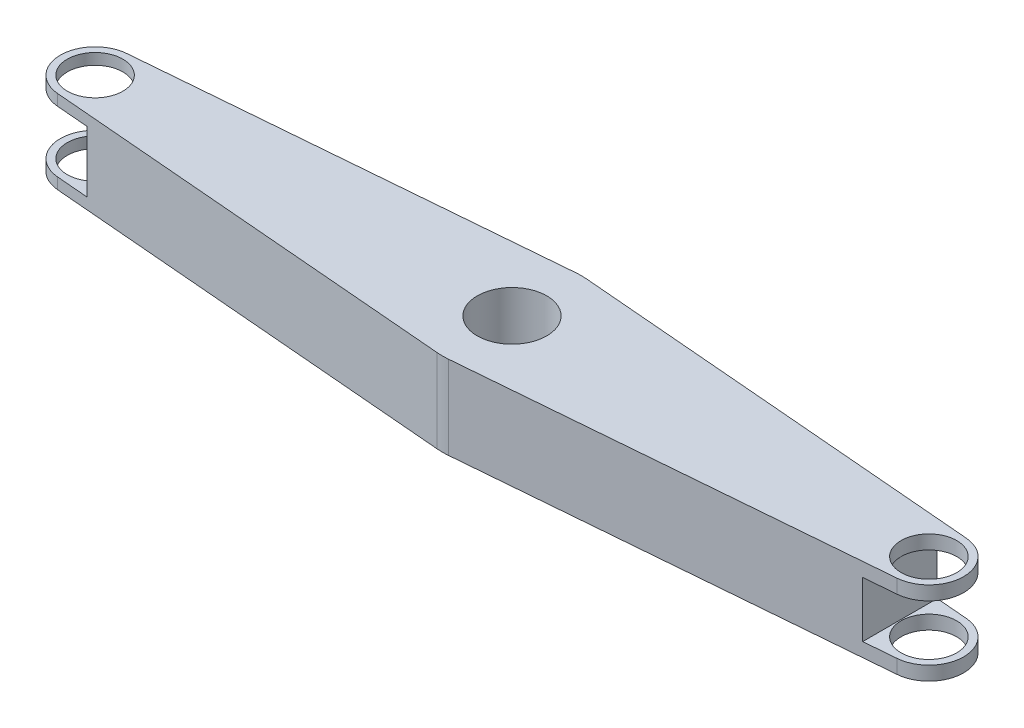
from build123d import *

# Parameters (mm, degrees)
CROQUIS1_R                 = 12.5
SALIENTE_EXTRUIR1_DEPTH    = 15
CORTAR_EXTRUIR1_DEPTH      = 166.094669811
CORTAR_EXTRUIR1_DEPTH_BACK = 166.094669811
CROQUIS2_W                 = 22.916666667
CROQUIS2_H                 = 20
CROQUIS2_H_2               = 22
CORTAR_EXTRUIR2_DEPTH      = 166.094669811
CORTAR_EXTRUIR2_DEPTH_BACK = 166.094669811
CROQUIS3_R                 = 10


with BuildPart() as part:
    # Croquis1 → Saliente-Extruir1 (new, symmetric)
    with BuildSketch(Plane(origin=(0, 0, 0), x_dir=(1, 0, 0), z_dir=(0, 1, 0))):
        with BuildLine():
            Line((-151.041666667, 12.456521607), (-2.083333333, 24.913043215))
            ThreePointArc((-2.083333333, 24.913043215), (0, 25), (2.083333333, 24.913043215))
            Line((2.083333333, 24.913043215), (151.041666667, 12.456521607))
            ThreePointArc((151.041666667, 12.456521607), (162.5, 0), (151.041666667, -12.456521607))
            Line((151.041666667, -12.456521607), (2.083333333, -24.913043215))
            ThreePointArc((2.083333333, -24.913043215), (0, -25), (-2.083333333, -24.913043215))
            Line((-2.083333333, -24.913043215), (-151.041666667, -12.456521607))
            ThreePointArc((-151.041666667, -12.456521607), (-162.5, 0), (-151.041666667, 12.456521607))
        make_face()
        Circle(CROQUIS1_R, mode=Mode.SUBTRACT)
    extrude(amount=SALIENTE_EXTRUIR1_DEPTH, both=True)

    # Croquis2 → Cortar-Extruir1 (cut, two sides: drawn at the far end of the back side and taken through both)
    with BuildSketch(Plane.XY.offset(-CORTAR_EXTRUIR1_DEPTH_BACK)):
        with Locations((151.041666667, 0)):
            Rectangle(CROQUIS2_W, CROQUIS2_H)
        with Locations((-151.041666667, 0)):
            Rectangle(CROQUIS2_W, CROQUIS2_H_2)
    extrude(amount=CORTAR_EXTRUIR1_DEPTH + CORTAR_EXTRUIR1_DEPTH_BACK, mode=Mode.SUBTRACT)

    # Croquis3 → Cortar-Extruir2 (cut, two sides: drawn at the far end of the back side and taken through both)
    with BuildSketch(Plane(origin=(0, 0, 0), x_dir=(1, 0, 0), z_dir=(0, 1, 0)).offset(-CORTAR_EXTRUIR2_DEPTH_BACK)):
        with Locations((-150, 0)):
            Circle(CROQUIS3_R)
        with Locations((150, 0)):
            Circle(CROQUIS3_R)
    extrude(amount=CORTAR_EXTRUIR2_DEPTH + CORTAR_EXTRUIR2_DEPTH_BACK, mode=Mode.SUBTRACT)


solid = part.part
